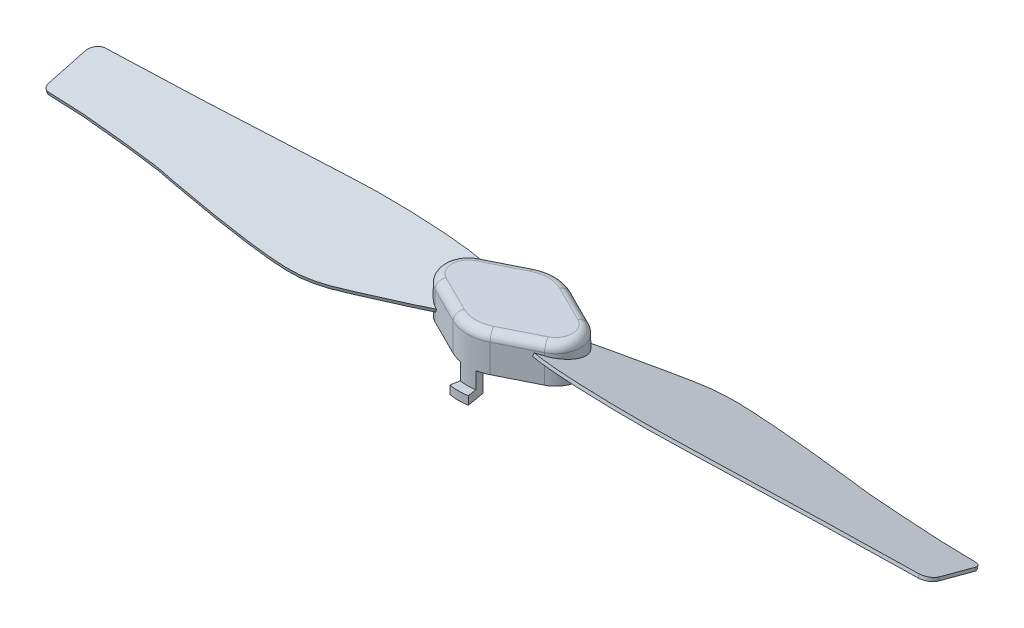
from build123d import *

# Parameters (mm, degrees)
EXTRUDE_START            = 2
EXTRUDE_1_DEPTH          = 3.2
EXTRUDE_3_DEPTH          = 0.1
PATTERN_CIRCULAR_1_COUNT = 2
SCALE_1_SCALE            = 2
FILLET_4_R               = 3
FILLET_5_R               = 5
FILLET_6_R               = 1
CUT_EXTRUDE_START        = -2
CUT_EXTRUDE_2_DEPTH      = 2
EXTRUDE_4_DEPTH          = 1
SCALE_2_SCALE            = 1.2
SKETCH_11_R              = 1
CUT_EXTRUDE_1_DEPTH      = 10


with BuildPart() as part:
    # 草图1 → 凸台-拉伸1 (new body)
    with BuildSketch(Plane(origin=(0, 0, 0), x_dir=(1, 0, 0), z_dir=(0, 1, 0)).offset(EXTRUDE_START)):
        Polygon((0, 2.9999999999999987), (-6, -8.7e-16), (0, -3.0000000000000013), (6, -8.7e-16), align=None)
    extrude(amount=EXTRUDE_1_DEPTH)

    # 草图9 → 凸台-拉伸3 (add, symmetric)
    with BuildSketch(Plane(origin=(0, 3.797877056362574, 1.0176380902050437), x_dir=(1, 0, 0), z_dir=(0, -0.9659258262890681, -0.25881904510252135))):
        with BuildLine():
            Line((-26.704099966580973, 0.3228041612460983), (-26.704099966580973, -1.9456761450061155))
            ThreePointArc((-26.704099966580973, -1.9456761450061155), (-26.533870316829233, -2.3867624553547033), (-26.111452674601363, -2.5991267705448466))
            add(Edge.make_bspline(
                [(-26.111452674601363, -2.5991267705448466), (-22.91052955721552, -2.689038243060296), (-24.11600085649285, -2.647838483964524), (-17.55233762123022, -2.8675340095287067), (-13.329663826254631, -3.0646436883019175), (-9.295103789130488, -3.2316401812276747), (-3.3382956120395084, -3.0618584532998), (-1.3944307323966896, -1.9667682940381868), (2.5093571682922495, 0.10610292246982139), (-1.4328853293939272, -0.5176380902050427)],
                knots=[0, 0, 0, 0, 0.21391373935722907, 0.26957603752511283, 0.5247288767728682, 0.5822784270431667, 0.7875219899577989, 0.8184556881986614, 1, 1, 1, 1], degree=3))
            add(Edge.make_bspline(
                [(-1.4328853293939272, -0.5176380902050427), (-2.7254157371995125, 0.27488564280840305), (-2.9583478396869727, 0.3643261996773897), (-7.694909114548022, 1.9383194941570494), (-9.152331340020703, 2.4326101573356893), (-12.990392513685167, 2.1706227424022266), (-15.907183554042758, 1.747793942402001), (-19.098378261811416, 1.2660471225422296), (-18.80374303384359, 1.197314804012044), (-24.763605801949996, 0.7054991365312095), (-25.80195775381894, 0.7263718807801985), (-26.339263844723146, 0.6876014087170593)],
                knots=[0, 0, 0, 0, 0.27318993124150337, 0.32414467973247946, 0.4889471732233965, 0.5311525810637701, 0.7039933502958418, 0.7485062511039996, 0.9317686883371911, 0.9592088436922059, 1, 1, 1, 1], degree=3))
            ThreePointArc((-26.339263844723146, 0.6876014087170593), (-26.597239582143125, 0.5807685132284266), (-26.704099966580973, 0.3228041612460983))
        make_face()
    extrude(amount=EXTRUDE_3_DEPTH, both=True)

    # 阵列(圆周)1: part ×2 about axis
    pattern_circular_1_axis = Axis((0, 4.339942807531289, 0), (0, -1, 0))


with BuildPart() as part_1:
    add(part.part)
    for i in range(1, PATTERN_CIRCULAR_1_COUNT):
        add(part.part.rotate(pattern_circular_1_axis, i * 360 / PATTERN_CIRCULAR_1_COUNT))


with BuildPart() as part_2:
    # 缩放比例1: scaled about (0, 0, 0)
    add(part_1.part.scale(SCALE_1_SCALE))

    # 圆角4
    fillet_4_edges = [part_2.edges().sort_by_distance(p)[0] for p in [
        (-12, 9.374079978861174, 1.73e-15),
        (12, 9.374079978861174, 1.73e-15),
        (-12, 5.967024742779158, 1.73e-15),
        (12, 5.967024742779158, 1.73e-15),
    ]]
    fillet(fillet_4_edges, radius=FILLET_4_R)

    # 圆角5
    fillet_5_edges = [part_2.edges().sort_by_distance(p)[0] for p in [
        (0, 7.2, 6.000000000000003),
        (0, 7.2, -5.999999999999997),
    ]]
    fillet(fillet_5_edges, radius=FILLET_5_R)

    # 圆角6
    fillet_6_edges = [part_2.edges().sort_by_distance(p)[0] for p in [
        (-8.29179606750063, 10.4, 2.93e-15),
        (-4.434752415750148, 10.4, -3.7826237921249235),
        (-5.05e-15, 10.4, -5.409830056250526),
        (4.434752415750145, 10.4, -3.7826237921249253),
        (8.29179606750063, 10.4, 4.6e-16),
        (4.434752415750148, 10.4, 3.782623792124929),
        (-1.72e-15, 10.4, 5.409830056250529),
        (-4.434752415750147, 10.4, 3.782623792124929),
    ]]
    fillet(fillet_6_edges, radius=FILLET_6_R)

    # 草图15 → 切除-拉伸2 (cut)
    with BuildSketch(Plane.XZ.offset(-4).offset(CUT_EXTRUDE_START)):
        with BuildLine():
            ThreePointArc((-2.2360679774997916, -4.881966011250103), (-1.6022624606124998, -5.1461529978701055), (-0.9382380047215096, -5.321012138651479))
            Line((-0.9382380047215095, -5.32101213865148), (-0.746687163967802, -4.2346733379524935))
            ThreePointArc((-0.746687163967823, -4.234673337952491), (-1.607e-14, -4.3), (0.746687163967795, -4.234673337952495))
            Line((0.7466871639677719, -4.234673337952499), (0.9382380047214718, -5.321012138651487))
            ThreePointArc((0.9382380047214719, -5.321012138651488), (1.602262460612478, -5.146152997870114), (2.236067977499784, -4.881966011250107))
            Line((2.236067977499784, -4.881966011250106), (6.633436854000504, -2.6832815729997463))
            ThreePointArc((6.633436854000504, -2.683281572999746), (8.29179606750063, 2.11e-15), (6.633436854000504, 2.6832815729997503))
            Line((6.633436854000504, 2.6832815729997503), (2.23606797749979, 4.881966011250108))
            ThreePointArc((2.2360679774997902, 4.881966011250109), (1.6022624606124998, 5.146152997870111), (0.938238004721511, 5.321012138651485))
            Line((0.9382380047215104, 5.321012138651485), (0.7466871639678019, 4.234673337952493))
            ThreePointArc((0.7466871639678262, 4.23467333795249), (1.554e-14, 4.3), (-0.7466871639677947, 4.234673337952496))
            Line((-0.7466871639677716, 4.234673337952499), (-0.9382380047214723, 5.321012138651493))
            ThreePointArc((-0.938238004721473, 5.321012138651492), (-1.6022624606124816, 5.146152997870118), (-2.2360679774997916, 4.881966011250107))
            Line((-2.236067977499792, 4.881966011250106), (-6.633436854000504, 2.6832815729997503))
            ThreePointArc((-6.633436854000504, 2.6832815729997503), (-8.29179606750063, 2.33e-15), (-6.633436854000505, -2.683281572999746))
            Line((-6.633436854000505, -2.6832815729997455), (-2.2360679774997907, -4.881966011250102))
        make_face()
    extrude(amount=CUT_EXTRUDE_2_DEPTH, mode=Mode.SUBTRACT)

    # 草图17 → 凸台-拉伸4 (add)
    with BuildSketch(Plane.XZ.offset(-4)):
        with BuildLine():
            ThreePointArc((1.1287131548350022, 6.40125039457936), (-1.05e-15, 6.5), (-1.1287131548350045, 6.40125039457936))
            Line((-1.128713154835004, 6.4012503945793595), (-0.7466871639677719, 4.234673337952501))
            ThreePointArc((-0.746687163967772, 4.234673337952501), (1.54e-14, 4.300000000000001), (0.7466871639678024, 4.234673337952494))
            Line((0.7466871639678023, 4.234673337952494), (1.128713154835003, 6.401250394579361))
        make_face()
        with BuildLine():
            ThreePointArc((-1.1287131548350018, -6.40125039457936), (-1.19e-15, -6.5), (1.1287131548349993, -6.40125039457936))
            Line((1.1287131548350042, -6.4012503945793595), (0.7466871639677721, -4.2346733379525))
            ThreePointArc((0.7466871639677721, -4.2346733379525), (-1.527e-14, -4.300000000000001), (-0.7466871639678021, -4.234673337952494))
            Line((-0.7466871639678021, -4.234673337952494), (-1.1287131548350022, -6.401250394579361))
        make_face()
    extrude(amount=EXTRUDE_4_DEPTH)


with BuildPart() as part_3:
    # 缩放比例2: scaled about (0, 8.019284702, 0)
    add(part_2.part.scale(SCALE_2_SCALE).moved(Location((0, -1.6038569403999996, 0))))

    # 草图11 → 切除-拉伸1 (cut)
    with BuildSketch(Plane.XZ):
        Circle(SKETCH_11_R)
    extrude(amount=-CUT_EXTRUDE_1_DEPTH, mode=Mode.SUBTRACT)


solid = part_3.part
